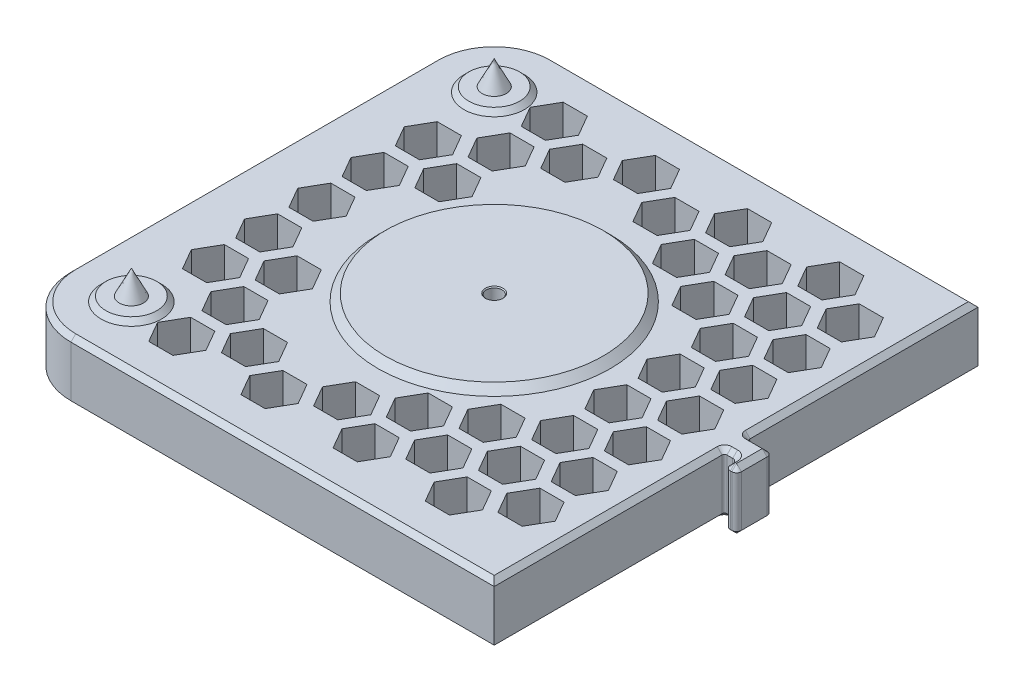
from build123d import *

# Parameters (mm, degrees)
SKETCH1_W                = 200
SKETCH1_H                = 200
BOSS_EXTRUDE1_DEPTH      = 25
BOSS_EXTRUDE3_DEPTH      = 25
FILLET1_R                = 1
FILLET2_R                = 25
SKETCH5_R                = 45
BOSS_EXTRUDE4_DEPTH      = 3
CHAMFER1_SIZE            = 3
CHAMFER2_SIZE            = 2
CHAMFER3_SIZE            = 2
SKETCH6_R                = 12.5
BOSS_EXTRUDE5_DEPTH      = 2
CHAMFER4_SIZE            = 2
CHAMFER4_OF_MIRROR1_SIZE = 2
FILL_PATTERN1_DEPTH      = 25
SKETCH8_R                = 3.25
CUT_EXTRUDE1_DEPTH       = 10
CHAMFER5_SIZE            = 0.4


# Read off the part's stored shape, not the designer's step: Fill Pattern1
with BuildPart() as part:
    # Sketch1 → Boss-Extrude1 (new body)
    with BuildSketch(Plane(origin=(0, 0, 0), x_dir=(1, 0, 0), z_dir=(0, 1, 0))):
        Rectangle(SKETCH1_W, SKETCH1_H)
    extrude(amount=BOSS_EXTRUDE1_DEPTH)

    # Sketch4 → Boss-Extrude3 (add)
    with BuildSketch(Plane(origin=(0, 0, 0), x_dir=(1, 0, 0), z_dir=(0, 1, 0))):
        with BuildLine():
            Line((100, 4.8), (108, 4.8))
            ThreePointArc((108, 4.8), (109.414213562, 4.214213562), (110, 2.8))
            Line((110, 2.8), (110, -7.8))
            ThreePointArc((110, -7.8), (109.414213562, -9.214213562), (108, -9.8))
            Line((108, -9.8), (107.4, -9.8))
            ThreePointArc((107.4, -9.8), (105.985786438, -9.214213562), (105.4, -7.8))
            Line((105.4, -7.8), (105.4, -6.8))
            ThreePointArc((105.4, -6.8), (104.814213562, -5.385786438), (103.4, -4.8))
            Line((103.4, -4.8), (100, -4.8))
            Line((100, -4.8), (100, 4.8))
        make_face()
    extrude(amount=BOSS_EXTRUDE3_DEPTH)

    # Fillet1
    fillet1_edges = [part.edges().sort_by_distance(p)[0] for p in [
        (100, 12.5, -4.8),
        (100, 12.5, 4.8),
    ]]
    fillet(fillet1_edges, radius=FILLET1_R)

    # Fillet2
    fillet2_edges = [part.edges().sort_by_distance(p)[0] for p in [
        (-100, 12.5, -100),
        (-100, 12.5, 100),
    ]]
    fillet(fillet2_edges, radius=FILLET2_R)

    # Sketch5 → Boss-Extrude4 (add)
    with BuildSketch(Plane(origin=(0, 25, 0), x_dir=(1, 0, 0), z_dir=(0, 1, 0))):
        with Locations(Location((0, 0, 0), (0, 0, 270))):
            Circle(SKETCH5_R)
    extrude(amount=BOSS_EXTRUDE4_DEPTH)

    # Chamfer1
    chamfer1_edges = [part.edges().sort_by_distance(p)[0] for p in [
        (0, 25, -45),
    ]]
    chamfer(chamfer1_edges, length=CHAMFER1_SIZE - 0.0001)  # a hair under: the kernel refuses the full size

    # Chamfer2
    chamfer2_edges = [part.edges().sort_by_distance(p)[0] for p in [
        (100, 25, 52.9),
        (12.5, 25, -100),
        (104.814213562, 25, 5.385786438),
        (105.4, 25, 7.3),
        (105.985786438, 25, 9.214213562),
        (107.7, 25, 9.8),
        (109.414213562, 25, 9.214213562),
        (110, 25, 2.5),
        (109.414213562, 25, -4.214213562),
        (104.5, 25, -4.8),
        (100, 25, -52.9),
        (102.2, 25, 4.8),
        (100.292893219, 25, -5.092893219),
        (100.292893219, 25, 5.092893219),
        (-100, 25, 0),
        (12.5, 25, 100),
        (-92.67766953, 25, 92.67766953),
        (-92.67766953, 25, -92.67766953),
    ]]
    chamfer(chamfer2_edges, length=CHAMFER2_SIZE - 0.0001)  # a hair under: the kernel refuses the full size

    # Chamfer3
    chamfer3_edges = [part.edges().sort_by_distance(p)[0] for p in [
        (104.814213562, 0, 5.385786438),
        (105.4, 0, 7.3),
        (105.985786438, 0, 9.214213562),
        (107.7, 0, 9.8),
        (109.414213562, 0, 9.214213562),
        (110, 0, 2.5),
        (109.414213562, 0, -4.214213562),
        (104.5, 0, -4.8),
        (100, 0, -52.9),
        (102.2, 0, 4.8),
        (100.292893219, 0, -5.092893219),
        (100.292893219, 0, 5.092893219),
        (12.5, 0, -100),
        (-100, 0, 0),
        (100, 0, 52.9),
        (12.5, 0, 100),
        (-92.67766953, 0, 92.67766953),
        (-92.67766953, 0, -92.67766953),
    ]]
    chamfer(chamfer3_edges, length=CHAMFER3_SIZE)

    # Sketch6 → Boss-Extrude5 (add)
    with BuildSketch(Plane(origin=(0, 25, 0), x_dir=(1, 0, 0), z_dir=(0, 1, 0))):
        with Locations(Location((-75, 75, 0), (0, 0, 270))):
            Circle(SKETCH6_R)
    boss_extrude5 = extrude(amount=BOSS_EXTRUDE5_DEPTH)

    # Sketch7 → Revolve1 (revolve)
    with BuildSketch(Plane(origin=(0, 0, -75), x_dir=(0, -1, 0), z_dir=(0, 0, 1)), mode=Mode.PRIVATE) as revolve1_sk:
        Polygon((-27, -70), (-27, -75), (-37, -75), align=None)
    revolve1 = revolve(revolve1_sk.sketch.rotate(Axis((-75, 27, -75), (0, 1, 0)), 90), axis=Axis((-75, 27, -75), (0, 1, 0)))

    # Chamfer4
    chamfer4_edges = [part.edges().sort_by_distance(p)[0] for p in [
        (-75, 27, -87.5),
    ]]
    chamfer(chamfer4_edges, length=CHAMFER4_SIZE - 0.0001)  # a hair under: the kernel refuses the full size

    # Mirror1: Boss-Extrude5, Revolve1 across plane
    add(boss_extrude5.mirror(Plane.XY))
    add(revolve1.mirror(Plane.XY))

    # Chamfer4 of Mirror1
    chamfer4_of_mirror1_edges = [part.edges().sort_by_distance(p)[0] for p in [
        (-75, 27, 87.5),
    ]]
    chamfer(chamfer4_of_mirror1_edges, length=CHAMFER4_OF_MIRROR1_SIZE - 0.0001)  # a hair under: the kernel refuses the full size

    # Fill Pattern1 outline → Fill Pattern1 (cut)
    with BuildSketch(Plane(origin=(0, 0, 0), x_dir=(1, 0, 0), z_dir=(0, 1, 0))):
        Polygon((-62.15767665, 77), (-57.15767665, 68.339745962), (-47.15767665, 68.339745962), (-42.15767665, 77), (-47.15767665, 85.660254038), (-57.15767665, 85.660254038), align=None)
        Polygon((14.052558883, -55), (19.052558883, -63.660254038), (29.052558883, -63.660254038), (34.052558883, -55), (29.052558883, -46.339745962), (19.052558883, -46.339745962), align=None)
        Polygon((57.15767665, 68.339745962), (67.15767665, 68.339745962), (72.15767665, 77), (67.15767665, 85.660254038), (57.15767665, 85.660254038), (52.15767665, 77), align=None)
        Polygon((19.052558883, 68.339745962), (29.052558883, 68.339745962), (34.052558883, 77), (29.052558883, 85.660254038), (19.052558883, 85.660254038), (14.052558883, 77), align=None)
        Polygon((-19.052558883, 68.339745962), (-9.052558883, 68.339745962), (-4.052558883, 77), (-9.052558883, 85.660254038), (-19.052558883, 85.660254038), (-24.052558883, 77), align=None)
        Polygon((-66.210235533, 35.339745962), (-61.210235533, 44), (-66.210235533, 52.660254038), (-76.210235533, 52.660254038), (-81.210235533, 44), (-76.210235533, 35.339745962), align=None)
        Polygon((-57.15767665, -63.660254038), (-47.15767665, -63.660254038), (-42.15767665, -55), (-47.15767665, -46.339745962), (-57.15767665, -46.339745962), (-62.15767665, -55), align=None)
        Polygon((57.15767665, -63.660254038), (67.15767665, -63.660254038), (72.15767665, -55), (67.15767665, -46.339745962), (57.15767665, -46.339745962), (52.15767665, -55), align=None)
        Polygon((67.15767665, 2.339745962), (72.15767665, 11), (67.15767665, 19.660254038), (57.15767665, 19.660254038), (52.15767665, 11), (57.15767665, 2.339745962), align=None)
        Polygon((86.210235533, 35.339745962), (91.210235533, 44), (86.210235533, 52.660254038), (76.210235533, 52.660254038), (71.210235533, 44), (76.210235533, 35.339745962), align=None)
        Polygon((-62.15767665, -77), (-57.15767665, -85.660254038), (-47.15767665, -85.660254038), (-42.15767665, -77), (-47.15767665, -68.339745962), (-57.15767665, -68.339745962), align=None)
        Polygon((-81.210235533, -44), (-76.210235533, -52.660254038), (-66.210235533, -52.660254038), (-61.210235533, -44), (-66.210235533, -35.339745962), (-76.210235533, -35.339745962), align=None)
        Polygon((-19.052558883, -85.660254038), (-9.052558883, -85.660254038), (-4.052558883, -77), (-9.052558883, -68.339745962), (-19.052558883, -68.339745962), (-24.052558883, -77), align=None)
        Polygon((19.052558883, -85.660254038), (29.052558883, -85.660254038), (34.052558883, -77), (29.052558883, -68.339745962), (19.052558883, -68.339745962), (14.052558883, -77), align=None)
        Polygon((57.15767665, -85.660254038), (67.15767665, -85.660254038), (72.15767665, -77), (67.15767665, -68.339745962), (57.15767665, -68.339745962), (52.15767665, -77), align=None)
        Polygon((29.052558883, 46.339745962), (34.052558883, 55), (29.052558883, 63.660254038), (19.052558883, 63.660254038), (14.052558883, 55), (19.052558883, 46.339745962), align=None)
        Polygon((76.210235533, -52.660254038), (86.210235533, -52.660254038), (91.210235533, -44), (86.210235533, -35.339745962), (76.210235533, -35.339745962), (71.210235533, -44), align=None)
        Polygon((38.105117767, -52.660254038), (48.105117767, -52.660254038), (53.105117767, -44), (48.105117767, -35.339745962), (38.105117767, -35.339745962), (33.105117767, -44), align=None)
        Polygon((-81.210235533, -22), (-76.210235533, -30.660254038), (-66.210235533, -30.660254038), (-61.210235533, -22), (-66.210235533, -13.339745962), (-76.210235533, -13.339745962), align=None)
        Polygon((76.210235533, -30.660254038), (86.210235533, -30.660254038), (91.210235533, -22), (86.210235533, -13.339745962), (76.210235533, -13.339745962), (71.210235533, -22), align=None)
        Polygon((-81.210235533, 22), (-76.210235533, 13.339745962), (-66.210235533, 13.339745962), (-61.210235533, 22), (-66.210235533, 30.660254038), (-76.210235533, 30.660254038), align=None)
        Polygon((67.15767665, 46.339745962), (72.15767665, 55), (67.15767665, 63.660254038), (57.15767665, 63.660254038), (52.15767665, 55), (57.15767665, 46.339745962), align=None)
        Polygon((-62.15767665, 55), (-57.15767665, 46.339745962), (-47.15767665, 46.339745962), (-42.15767665, 55), (-47.15767665, 63.660254038), (-57.15767665, 63.660254038), align=None)
        Polygon((86.210235533, 13.339745962), (91.210235533, 22), (86.210235533, 30.660254038), (76.210235533, 30.660254038), (71.210235533, 22), (76.210235533, 13.339745962), align=None)
        Polygon((67.15767665, -19.660254038), (72.15767665, -11), (67.15767665, -2.339745962), (57.15767665, -2.339745962), (52.15767665, -11), (57.15767665, -19.660254038), align=None)
        Polygon((-5, -66), (0, -74.660254038), (10, -74.660254038), (15, -66), (10, -57.339745962), (0, -57.339745962), align=None)
        Polygon((-62.15767665, 33), (-57.15767665, 24.339745962), (-47.15767665, 24.339745962), (-42.15767665, 33), (-47.15767665, 41.660254038), (-57.15767665, 41.660254038), align=None)
        Polygon((76.210235533, -74.660254038), (86.210235533, -74.660254038), (91.210235533, -66), (86.210235533, -57.339745962), (76.210235533, -57.339745962), (71.210235533, -66), align=None)
        Polygon((-38.105117767, -74.660254038), (-28.105117767, -74.660254038), (-23.105117767, -66), (-28.105117767, -57.339745962), (-38.105117767, -57.339745962), (-43.105117767, -66), align=None)
        Polygon((38.105117767, -74.660254038), (48.105117767, -74.660254038), (53.105117767, -66), (48.105117767, -57.339745962), (38.105117767, -57.339745962), (33.105117767, -66), align=None)
        Polygon((67.15767665, 24.339745962), (72.15767665, 33), (67.15767665, 41.660254038), (57.15767665, 41.660254038), (52.15767665, 33), (57.15767665, 24.339745962), align=None)
        Polygon((86.210235533, 57.339745962), (91.210235533, 66), (86.210235533, 74.660254038), (76.210235533, 74.660254038), (71.210235533, 66), (76.210235533, 57.339745962), align=None)
        Polygon((-5, 66), (0, 57.339745962), (10, 57.339745962), (15, 66), (10, 74.660254038), (0, 74.660254038), align=None)
        Polygon((52.15767665, -33), (57.15767665, -41.660254038), (67.15767665, -41.660254038), (72.15767665, -33), (67.15767665, -24.339745962), (57.15767665, -24.339745962), align=None)
        Polygon((-43.105117767, 66), (-38.105117767, 57.339745962), (-28.105117767, 57.339745962), (-23.105117767, 66), (-28.105117767, 74.660254038), (-38.105117767, 74.660254038), align=None)
        Polygon((38.105117767, 57.339745962), (48.105117767, 57.339745962), (53.105117767, 66), (48.105117767, 74.660254038), (38.105117767, 74.660254038), (33.105117767, 66), align=None)
        Polygon((-66.210235533, -8.660254038), (-61.210235533, 0), (-66.210235533, 8.660254038), (-76.210235533, 8.660254038), (-81.210235533, 0), (-76.210235533, -8.660254038), align=None)
        Polygon((-47.15767665, -41.660254038), (-42.15767665, -33), (-47.15767665, -24.339745962), (-57.15767665, -24.339745962), (-62.15767665, -33), (-57.15767665, -41.660254038), align=None)
        Polygon((71.210235533, 0), (76.210235533, -8.660254038), (86.210235533, -8.660254038), (91.210235533, 0), (86.210235533, 8.660254038), (76.210235533, 8.660254038), align=None)
        Polygon((33.105117767, 44), (38.105117767, 35.339745962), (48.105117767, 35.339745962), (53.105117767, 44), (48.105117767, 52.660254038), (38.105117767, 52.660254038), align=None)
    extrude(amount=FILL_PATTERN1_DEPTH, mode=Mode.SUBTRACT)

    # Sketch8 → Cut-Extrude1 (cut)
    with BuildSketch(Plane(origin=(0, 28, 0), x_dir=(1, 0, 0), z_dir=(0, 1, 0))):
        with Locations(Location((0, 0, 0), (0, 0, 270))):
            Circle(SKETCH8_R)
    extrude(amount=-CUT_EXTRUDE1_DEPTH, mode=Mode.SUBTRACT)

    # Chamfer5
    chamfer5_edges = [part.edges().sort_by_distance(p)[0] for p in [
        (0, 28, -3.25),
    ]]
    chamfer(chamfer5_edges, length=CHAMFER5_SIZE)


solid = part.part
